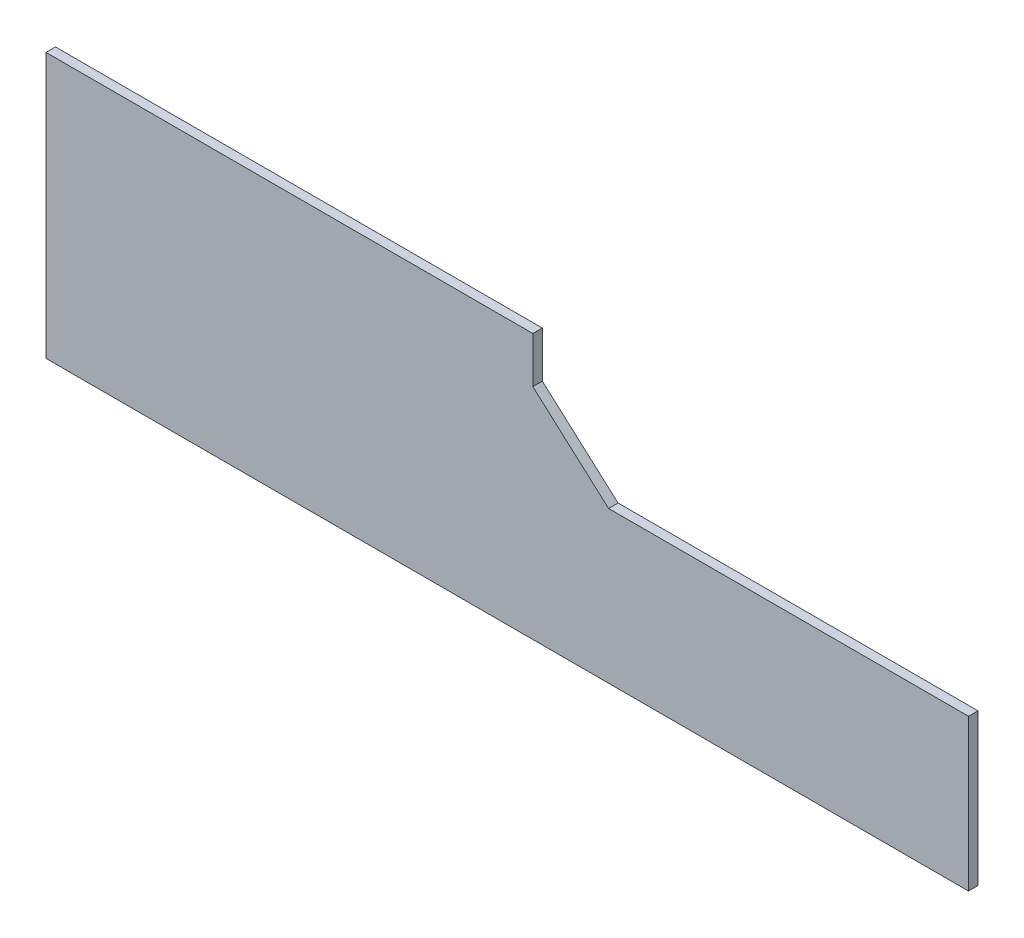
from build123d import *

# Parameters (mm, degrees)
SKETCH1_W           = 309.23
SKETCH1_H           = 88.841000118
BOSS_EXTRUDE1_DEPTH = 3.175
CUT_EXTRUDE2_DEPTH  = 161.90077587


with BuildPart() as part:
    # Sketch1 → Boss-Extrude1 (new body)
    with BuildSketch(Plane.XY):
        Rectangle(SKETCH1_W, SKETCH1_H)
    extrude(amount=BOSS_EXTRUDE1_DEPTH)

    # Sketch4 → Cut-Extrude2 (cut, through all)
    with BuildSketch(Plane.XY.offset(3.175)):
        Polygon((33.965, 6.320500059), (154.615, 6.320500059), (154.615, 44.420500059), (8.565, 44.420500059), (8.565, 29.000644342), align=None)
    extrude(amount=-CUT_EXTRUDE2_DEPTH, mode=Mode.SUBTRACT)


solid = part.part
